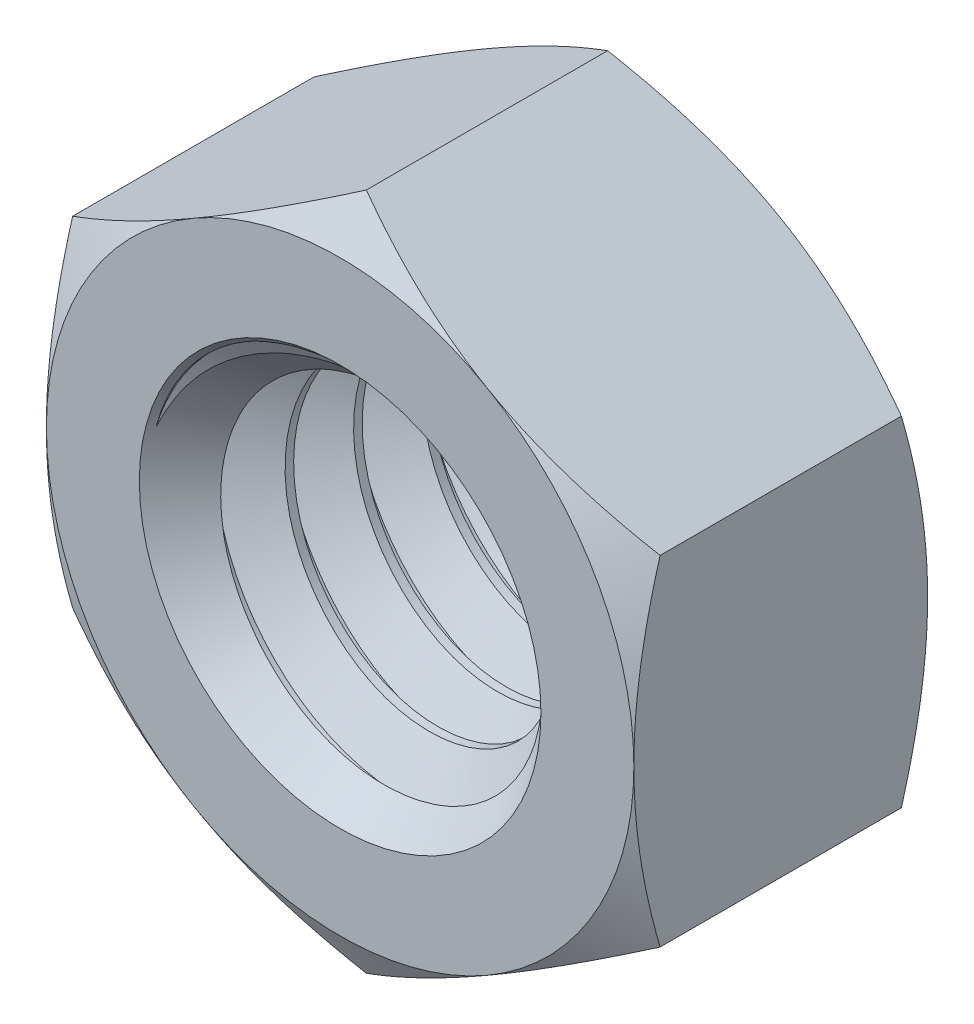
from build123d import *

# Parameters (mm, degrees)
EXTRUDE1_DEPTH          = 1.5
EXTRUDE1_DEPTH_BACK     = 1.5
SKETCH1_R               = 2
SWEEP1_PITCH            = 0.7
EXTRUDE2_DEPTH          = 6.889930711
SKETCH8_OUTSIDE_W       = 33.844
SKETCH8_OUTSIDE_H       = 34.772
SKETCH8_OUTSIDE_R       = 3
EXTRUDE4_DEPTH          = 6.889930711
EXTRUDE4_DRAFT          = -60
MIRROR1_COPY_1_SKETCH_W = 33.844
MIRROR1_COPY_1_SKETCH_H = 34.772
MIRROR1_COPY_1_SKETCH_R = 3
MIRROR1_COPY_1_DEPTH    = 6.889930711
MIRROR1_COPY_1_DRAFT    = -60


with BuildPart() as part:
    # Sketch1 → Extrude1 (new, two sides: drawn at the far end of the back side and taken through both)
    with BuildSketch(Plane.XY.offset(-EXTRUDE1_DEPTH_BACK)):
        Polygon((0, 3.464101615), (-3, 1.732050808), (-3, -1.732050808), (0, -3.464101615), (3, -1.732050808), (3, 1.732050808), align=None)
        Circle(SKETCH1_R, mode=Mode.SUBTRACT)
    extrude(amount=EXTRUDE1_DEPTH + EXTRUDE1_DEPTH_BACK)

    # Sweep1: the profile of Sketch12 profile screwed along a right-hand helix of 5.285714 turns, 6 arcs to a turn; built about Z, then put on its axis
    sweep1_z = Axis((0, 0, 0), (0, 0, 1))
    sweep1_corners = [(2.0003, 0, -0.612673205), (2.0003, 0, 0.000173205), (1.545336663, 0, -0.2625), (1.545336663, 0, -0.35)]
    with BuildLine(mode=Mode.PRIVATE) as sweep1_profile:
        Line(sweep1_corners[0], sweep1_corners[1])
        Line(sweep1_corners[1], sweep1_corners[2])
        Line(sweep1_corners[2], sweep1_corners[3])
        Line(sweep1_corners[3], sweep1_corners[0])
    sweep1_cap = Face(sweep1_profile.wire())
    sweep1_turn_angles = [0, 30, 60, 90, 120, 150, 180, 210, 240, 270, 300, 330, 360]
    sweep1_turn_weights = [1, 0.8660254037844387, 1, 0.8660254037844387, 1, 0.8660254037844387, 1, 0.8660254037844387, 1, 0.8660254037844387, 1, 0.8660254037844387, 1]
    sweep1_turn_rails = [Edge.make_bspline([Vector(p[0], p[1], 0).rotate(sweep1_z, sweep1_turn_angles[k]) / sweep1_turn_weights[k] + Vector(0, 0, p[2] + SWEEP1_PITCH * sweep1_turn_angles[k] / 360) for k in range(13)], [0, 0, 0, 1, 1, 2, 2, 3, 3, 4, 4, 5, 5, 6, 6, 6], 2, sweep1_turn_weights) for p in sweep1_corners]
    sweep1_turn_sides = [Face.make_surface_from_curves(sweep1_turn_rails[p[0]], sweep1_turn_rails[p[1]]) for p in [(0, 1), (1, 2), (2, 3), (3, 0)]]
    sweep1_last_angles = [1800, 1830, 1860, 1881.428571429, 1902.857142857]
    sweep1_last_weights = [1, 0.8660254037844387, 1, 0.930873748644186, 1]
    sweep1_last_rails = [Edge.make_bspline([Vector(p[0], p[1], 0).rotate(sweep1_z, sweep1_last_angles[k]) / sweep1_last_weights[k] + Vector(0, 0, p[2] + SWEEP1_PITCH * sweep1_last_angles[k] / 360) for k in range(5)], [0, 0, 0, 1, 1, 2, 2, 2], 2, sweep1_last_weights) for p in sweep1_corners]
    sweep1_last_sides = [Face.make_surface_from_curves(sweep1_last_rails[p[0]], sweep1_last_rails[p[1]]) for p in [(0, 1), (1, 2), (2, 3), (3, 0)]]
    sweep1 = Plane(origin=(0, 0, -1.5), x_dir=(0, 1, 0), z_dir=(0, 0, 1)) * Solid(Shell([*[p.moved(Location((0, 0, SWEEP1_PITCH * i))) for i in range(5) for p in sweep1_turn_sides], *sweep1_last_sides, sweep1_cap, sweep1_cap.rotate(sweep1_z, 1902.857142857).moved(Location((0, 0, SWEEP1_PITCH * 1902.857142857 / 360)))]))
    add(sweep1)

    # Sketch6 → Extrude2 (cut, through all)
    with BuildSketch(Plane(origin=(0, 0, -1.5), x_dir=(-1, 0, 0), z_dir=(0, 0, -1))):
        Polygon((0, 3.464101615), (-3, 1.732050808), (-3, -1.732050808), (0, -3.464101615), (3, -1.732050808), (3, 1.732050808), align=None)
    extrude2 = extrude(amount=EXTRUDE2_DEPTH, mode=Mode.SUBTRACT)

    # Extrude3 cone 1 section (through the dimple's axis) → Extrude3 (revolve, cut)
    with BuildSketch(Plane(origin=(0, 0, -1.5), x_dir=(0, 1, 0), z_dir=(1, 0, 0))):
        Polygon((0, 0), (2.0508, 0), (0, 2.199213751), align=None)
    extrude3 = revolve(axis=Axis((0, 0, -1.5), (0, 0, 1)), mode=Mode.SUBTRACT)


with BuildPart() as extrude4_tool:
    # Sketch8 outside → Extrude4 (with draft: the straight prism first)
    with BuildSketch(Plane(origin=(0, 0, -1.5), x_dir=(-1, 0, 0), z_dir=(0, 0, -1))):
        Rectangle(SKETCH8_OUTSIDE_W, SKETCH8_OUTSIDE_H)
        Circle(SKETCH8_OUTSIDE_R, mode=Mode.SUBTRACT)
    extrude(amount=-EXTRUDE4_DEPTH)
    # Extrude4: the draft: its side faces are tilted about the plane it starts from
    extrude4_sides = [extrude4_tool.faces().sort_by_distance(p)[0] for p in [
        (0, -17.386, 1.944965355),
        (-16.922, 0, 1.944965355),
        (0, 17.386, 1.944965355),
        (16.922, 0, 1.944965355),
        (3, 0, 1.944965355),
    ]]
    draft(extrude4_sides, Plane(origin=(0, 0, -1.5), x_dir=(-1, 0, 0), z_dir=(0, 0, -1)), EXTRUDE4_DRAFT)


with BuildPart() as part_1:
    add(part.part)

    # Extrude4: cut by extrude4_tool
    add(extrude4_tool.part, mode=Mode.SUBTRACT)

    # Mirror1: Extrude2, Extrude3 across plane
    add(extrude2.mirror(Plane.XY), mode=Mode.SUBTRACT)
    add(extrude3.mirror(Plane.XY), mode=Mode.SUBTRACT)


with BuildPart() as mirror1_copy_1_tool:
    # Mirror1 copy 1 sketch → Mirror1 copy 1 (with draft: the straight prism first)
    with BuildSketch(Plane(origin=(0, 0, 1.5), x_dir=(-1, 0, 0), z_dir=(0, 0, 1))):
        Rectangle(MIRROR1_COPY_1_SKETCH_W, MIRROR1_COPY_1_SKETCH_H)
        Circle(MIRROR1_COPY_1_SKETCH_R, mode=Mode.SUBTRACT)
    extrude(amount=-MIRROR1_COPY_1_DEPTH)
    # Mirror1 copy 1: the draft: its side faces are tilted about the plane it starts from
    mirror1_copy_1_sides = [mirror1_copy_1_tool.faces().sort_by_distance(p)[0] for p in [
        (0, -17.386, -1.944965355),
        (-16.922, 0, -1.944965355),
        (0, 17.386, -1.944965355),
        (16.922, 0, -1.944965355),
        (3, 0, -1.944965355),
    ]]
    draft(mirror1_copy_1_sides, Plane(origin=(0, 0, 1.5), x_dir=(-1, 0, 0), z_dir=(0, 0, 1)), MIRROR1_COPY_1_DRAFT)


with BuildPart() as part_2:
    add(part_1.part)

    # Mirror1 copy 1: cut by mirror1_copy_1_tool
    add(mirror1_copy_1_tool.part, mode=Mode.SUBTRACT)


solid = part_2.part
